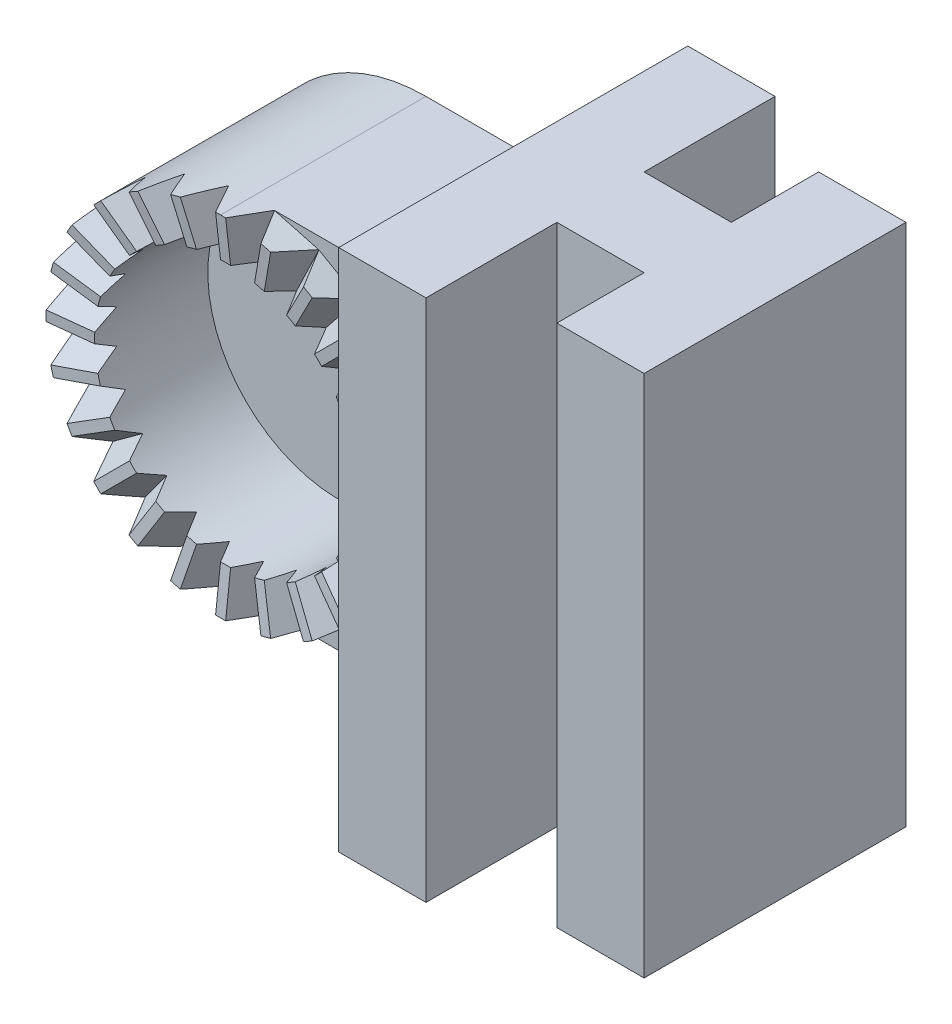
from build123d import *
from build123d.topology import SkipClean

# Parameters (mm, degrees)
BOSS_EXTRUDE1_DEPTH     = 20
BOSS_EXTRUDE2_DEPTH     = 30
BOSS_EXTRUDE3_DEPTH     = 10
CUT_EXTRUDE3_DEPTH      = 10
CUT_EXTRUDE3_DEPTH_BACK = 5
CIRPATTERN5_COUNT       = 24
CUT_EXTRUDE4_DEPTH      = 10
CUT_EXTRUDE5_DEPTH      = 20


with BuildPart() as part:
    # Sketch2 → Boss-Extrude1 (new body)
    with BuildSketch(Plane.XY):
        Polygon((20, -10), (20, 20), (15, 20), (15, 10), (15, -10), align=None)
    extrude(amount=BOSS_EXTRUDE1_DEPTH)

    # Sketch3 → Boss-Extrude2 (add)
    with BuildSketch(Plane.XZ.offset(10)):
        Polygon((20, 12.5), (25, 12.5), (25, 17.5), (30, 17.5), (30, 2.5), (25, 2.5), (25, 7.5), (20, 7.5), align=None)
    extrude(amount=-BOSS_EXTRUDE2_DEPTH)

    # Sketch2<3> → Boss-Extrude3 (add)
    with BuildSketch(Plane.XY):
        with BuildLine():
            Line((0, -10), (15, -10))
            Line((15, -10), (15, 10))
            Line((15, 10), (0, 10))
            ThreePointArc((0, 10), (-10, 0), (0, -10))
        make_face()
    extrude(amount=BOSS_EXTRUDE3_DEPTH)

    # Sketch4 → Cut-Extrude3 (cut, two sides: drawn at the far end of the back side and taken through both)
    with BuildSketch(Plane.XY.offset(10).offset(-CUT_EXTRUDE3_DEPTH_BACK)):
        with BuildLine():
            Line((-6.373543911, 3.953218691), (0, 0))
            Line((0, 0), (-5.133202382, 5.468110579))
            ThreePointArc((-5.133202382, 5.468110579), (-5.803018776, 4.751312774), (-6.373543911, 3.953218691))
        make_face()
        with BuildLine():
            Line((-5.133202382, 5.468110579), (0, 0))
            Line((0, 0), (-6.373543911, 3.953218691))
            ThreePointArc((-6.373543911, 3.953218691), (-2.055288382, -7.212890521), (7.5, 0))
            ThreePointArc((7.5, 0), (2.97917624, 6.882914276), (-5.133202382, 5.468110579))
        make_face()
    extrude(amount=CUT_EXTRUDE3_DEPTH + CUT_EXTRUDE3_DEPTH_BACK, mode=Mode.SUBTRACT)

    # Sketch5 → Loft1 section 0
    with BuildSketch(Plane.ZY.offset(10)):
        with BuildLine():
            Line((12.267, 0), (10, 1.30885306))
            Line((10, 1.30885306), (10, -1.30885306))
            Line((10, -1.30885306), (12.267, 0))
        make_face()
    # Sketch6 → Loft1 section 1
    with BuildSketch(Plane.ZY.offset(5)):
        with BuildLine():
            Line((10, 0.981495458), (10, -0.981495458))
            Line((10, -0.981495458), (11.7, 0))
            Line((11.7, 0), (10, 0.981495458))
        make_face()
    loft1 = loft()

    # CirPattern5: Loft1 ×24 about axis
    cirpattern5_axis = Axis((0, 0, 0), (0, 0, 1))
    for i in range(1, CIRPATTERN5_COUNT):
        add(loft1.rotate(cirpattern5_axis, i * 360 / CIRPATTERN5_COUNT))

    # Sketch4<6> → Cut-Extrude4 (cut)
    with BuildSketch(Plane.XY.offset(10)):
        with BuildLine():
            Line((-6.373543911, 3.953218691), (0, 0))
            Line((0, 0), (-5.133202382, 5.468110579))
            ThreePointArc((-5.133202382, 5.468110579), (-5.803018776, 4.751312774), (-6.373543911, 3.953218691))
        make_face()
        with BuildLine():
            Line((-5.133202382, 5.468110579), (0, 0))
            Line((0, 0), (-6.373543911, 3.953218691))
            ThreePointArc((-6.373543911, 3.953218691), (-2.055288382, -7.212890521), (7.5, 0))
            ThreePointArc((7.5, 0), (2.97917624, 6.882914276), (-5.133202382, 5.468110579))
        make_face()
    extrude(amount=CUT_EXTRUDE4_DEPTH, mode=Mode.SUBTRACT)

    # Sketch9 → Cut-Extrude5 (cut)
    with SkipClean():  # the faces are left unmerged after this step: merging them gives an invalid solid
        with BuildSketch(Plane.XY):
            with BuildLine():
                Line((0, 10), (0, 11))
                ThreePointArc((0, 11), (-11, 0), (0, -11))
                Line((0, -11), (0, -10))
                ThreePointArc((0, -10), (-10, 0), (0, 10))
            make_face()
        extrude(amount=CUT_EXTRUDE5_DEPTH, mode=Mode.SUBTRACT)
    add(part.part.scale(1), mode=Mode.REPLACE)  # the faces are merged on a copy

    # Sketch12 → Cut-Revolve2 (revolve, cut)
    with BuildSketch(Plane(origin=(0, 0, 0), x_dir=(1, 0, 0), z_dir=(0, 1, 0)), mode=Mode.PRIVATE) as cut_revolve2_sk:
        Polygon((-10.641898497, -12.33979129), (-10.601405469, -11.83519938), (-7.358546859, -11.467459214), (-7.358546859, -11.967459214), align=None)
    revolve(cut_revolve2_sk.sketch.rotate(Axis((0, 0, 31.943443077), (0, 0, -1)), 357.796914326), axis=Axis((0, 0, 31.943443077), (0, 0, -1)), mode=Mode.SUBTRACT)


solid = part.part
